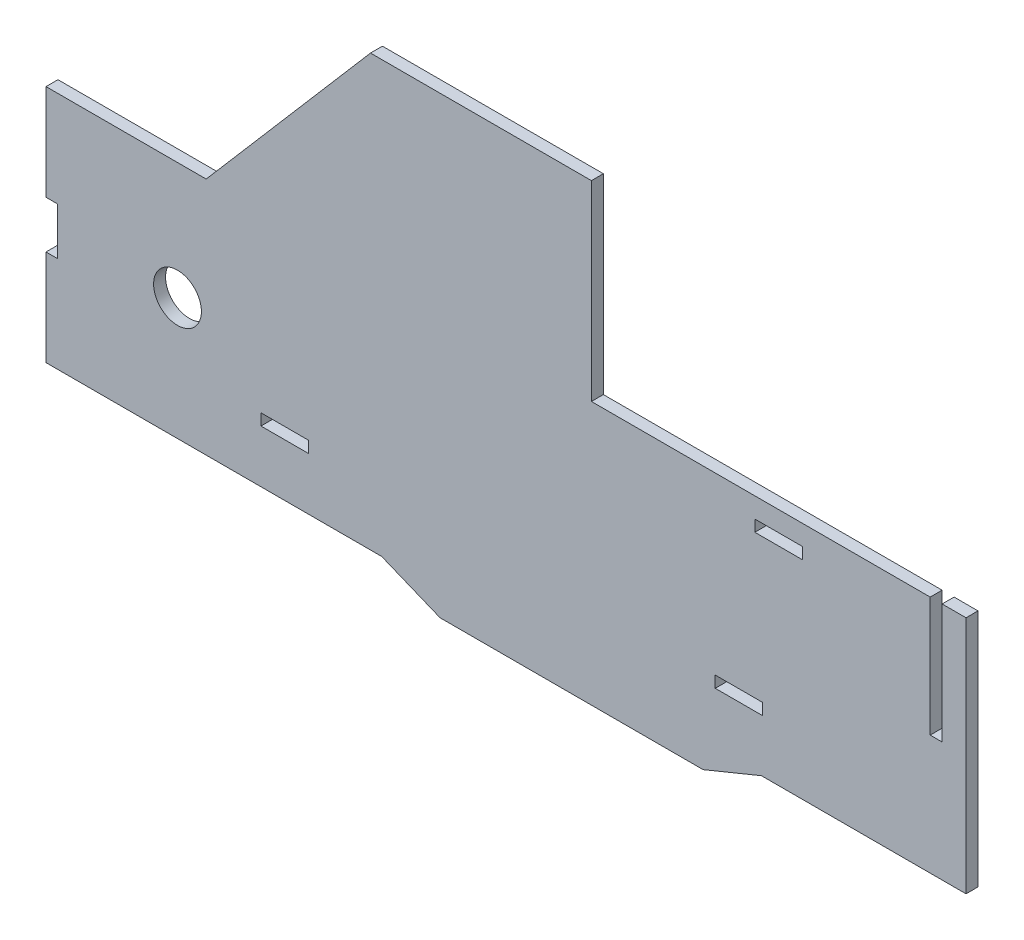
from build123d import *

# Parameters (mm, degrees)
MAIN_SIDE_DEPTH          = 3.175
SKETCH2_W                = 12.573
SKETCH2_H                = 3.048
BOTTOM_PLATE_HOLES_DEPTH = 239.465654669
SKETCH3_W                = 12.7
SKETCH3_H                = 3.048
CUT_EXTRUDE1_DEPTH       = 239.465654669
SKETCH4_W                = 3.048
SKETCH4_H                = 12.573
CUT_EXTRUDE2_DEPTH       = 239.465654669
SKETCH5_W                = 3.175
SKETCH5_H                = 31.75
CUT_EXTRUDE3_DEPTH       = 239.465654669
SKETCH6_R                = 6.35
CUT_EXTRUDE4_DEPTH       = 239.465654669


with BuildPart() as part:
    # Sketch1 → Main Side (new body)
    with BuildSketch(Plane.XY):
        Polygon((62.123903317, 6.35), (131.966346795, 6.35), (147.472889282, 12.7), (201.808790274, 12.7), (201.808790274, 76.2), (102.314133739, 76.2), (102.314133739, 127), (43.639361702, 127), (0, 76.2), (-42.539209726, 76.2), (-42.539209726, 12.7), (46.617360741, 12.7), align=None)
    extrude(amount=MAIN_SIDE_DEPTH)

    # Sketch2 → Bottom Plate Holes (cut, through all)
    with BuildSketch(Plane.XY.offset(3.175)):
        with Locations((141.483790274, 28.194)):
            Rectangle(SKETCH2_W, SKETCH2_H)
        with Locations((20.833790274, 28.194)):
            Rectangle(SKETCH2_W, SKETCH2_H)
    extrude(amount=-BOTTOM_PLATE_HOLES_DEPTH, mode=Mode.SUBTRACT)

    # Sketch3 → Cut-Extrude1 (cut, through all)
    with BuildSketch(Plane.XY.offset(3.175)):
        with Locations((152.061462006, 69.342)):
            Rectangle(SKETCH3_W, SKETCH3_H)
    extrude(amount=-CUT_EXTRUDE1_DEPTH, mode=Mode.SUBTRACT)

    # Sketch4 → Cut-Extrude2 (cut, through all)
    with BuildSketch(Plane.XY.offset(3.175)):
        with Locations((-41.015209726, 44.45)):
            Rectangle(SKETCH4_W, SKETCH4_H)
    extrude(amount=-CUT_EXTRUDE2_DEPTH, mode=Mode.SUBTRACT)

    # Sketch5 → Cut-Extrude3 (cut, through all)
    with BuildSketch(Plane.XY.offset(3.175)):
        with Locations((193.871290274, 60.325)):
            Rectangle(SKETCH5_W, SKETCH5_H)
    extrude(amount=-CUT_EXTRUDE3_DEPTH, mode=Mode.SUBTRACT)

    # Sketch6 → Cut-Extrude4 (cut, through all)
    with BuildSketch(Plane.XY.offset(3.175)):
        with Locations((-7.614209726, 45.085)):
            Circle(SKETCH6_R)
    extrude(amount=-CUT_EXTRUDE4_DEPTH, mode=Mode.SUBTRACT)


solid = part.part
